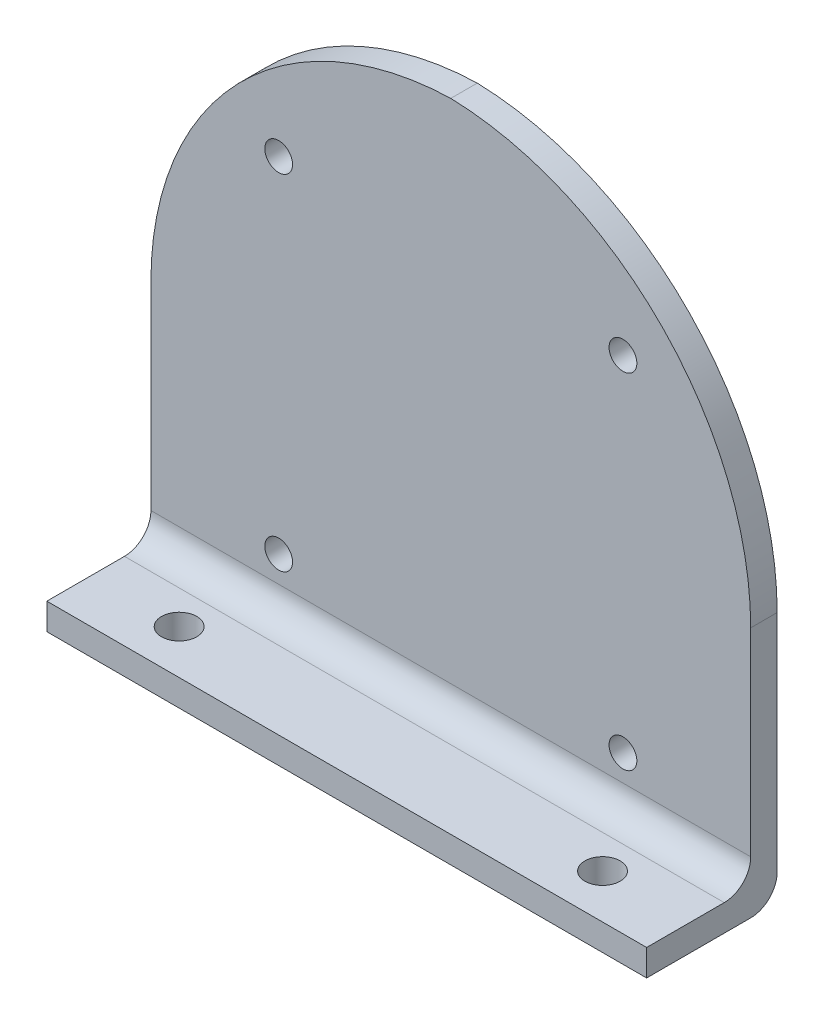
from build123d import *

# Parameters (mm, degrees)
SKETCH_1_W          = 68
SKETCH_1_H          = 80
EXTRUDE_1_DEPTH     = 3
SKETCH_2_R          = 1.575
CUT_EXTRUDE_1_DEPTH = 53.583267301
SKETCH_4_W          = 68
SKETCH_4_H          = 16.52
CUT_EXTRUDE_2_DEPTH = 53.583267301
SKETCH_5_W          = 68
SKETCH_5_H          = 3
EXTRUDE_2_DEPTH     = 11.8
FILLET_1_R          = 3
SKETCH_6_R          = 2
CUT_EXTRUDE_3_DEPTH = 14.5
FILLET_2_R          = 35


with BuildPart() as part:
    # 草图1 → 凸台-拉伸1 (new body)
    with BuildSketch(Plane.XY):
        Rectangle(SKETCH_1_W, SKETCH_1_H)
    extrude(amount=EXTRUDE_1_DEPTH)

    # 草图2 → 切除-拉伸1 (cut, through all)
    with BuildSketch(Plane.XY.offset(3)):
        with Locations((-19.516147161, 24.516147161)):
            Circle(SKETCH_2_R)
        with Locations((19.516147161, 24.516147161)):
            Circle(SKETCH_2_R)
        with Locations((-19.516147161, -14.516147161)):
            Circle(SKETCH_2_R)
        with Locations((19.516147161, -14.516147161)):
            Circle(SKETCH_2_R)
    extrude(amount=-CUT_EXTRUDE_1_DEPTH, mode=Mode.SUBTRACT)

    # 草图4 → 切除-拉伸2 (cut, through all)
    with BuildSketch(Plane.XY.offset(3)):
        with Locations((0, -31.74)):
            Rectangle(SKETCH_4_W, SKETCH_4_H)
    extrude(amount=-CUT_EXTRUDE_2_DEPTH, mode=Mode.SUBTRACT)

    # 草图5 → 凸台-拉伸2 (add)
    with BuildSketch(Plane.XY.offset(3)):
        with Locations((0, -21.98)):
            Rectangle(SKETCH_5_W, SKETCH_5_H)
    extrude(amount=EXTRUDE_2_DEPTH)

    # 圆角1
    fillet_1_edges = [part.edges().sort_by_distance(p)[0] for p in [
        (0, -23.48, 0),
        (0, -20.48, 3),
    ]]
    fillet(fillet_1_edges, radius=FILLET_1_R)

    # 草图6 → 切除-拉伸3 (cut)
    with BuildSketch(Plane(origin=(0, -20.48, 0), x_dir=(1, 0, 0), z_dir=(0, 1, 0))):
        with Locations(Location((24, -9.8, 0), (0, 0, 270))):
            Circle(SKETCH_6_R)
        with Locations(Location((-24, -9.8, 0), (0, 0, 270))):
            Circle(SKETCH_6_R)
    extrude(amount=-CUT_EXTRUDE_3_DEPTH, mode=Mode.SUBTRACT)

    # 圆角2
    # the kernel refuses this fillet: 35 mm, written as the material it takes off along each edge
    with BuildSketch(Plane(origin=(34, 40, -87.5), x_dir=(-1, 0, 0), z_dir=(0, 0, 1)), Plane(origin=(-34, 40, -87.5), x_dir=(0, -1, 0), z_dir=(0, 0, 1))) as fillet_2_piece_1:
        with BuildLine():
            CenterArc((FILLET_2_R, FILLET_2_R), FILLET_2_R, 180, 90)
            Line((0, FILLET_2_R), (0, 0))
            Line((0, 0), (FILLET_2_R, 0))
        make_face()
    extrude(amount=178, mode=Mode.SUBTRACT)


solid = part.part
